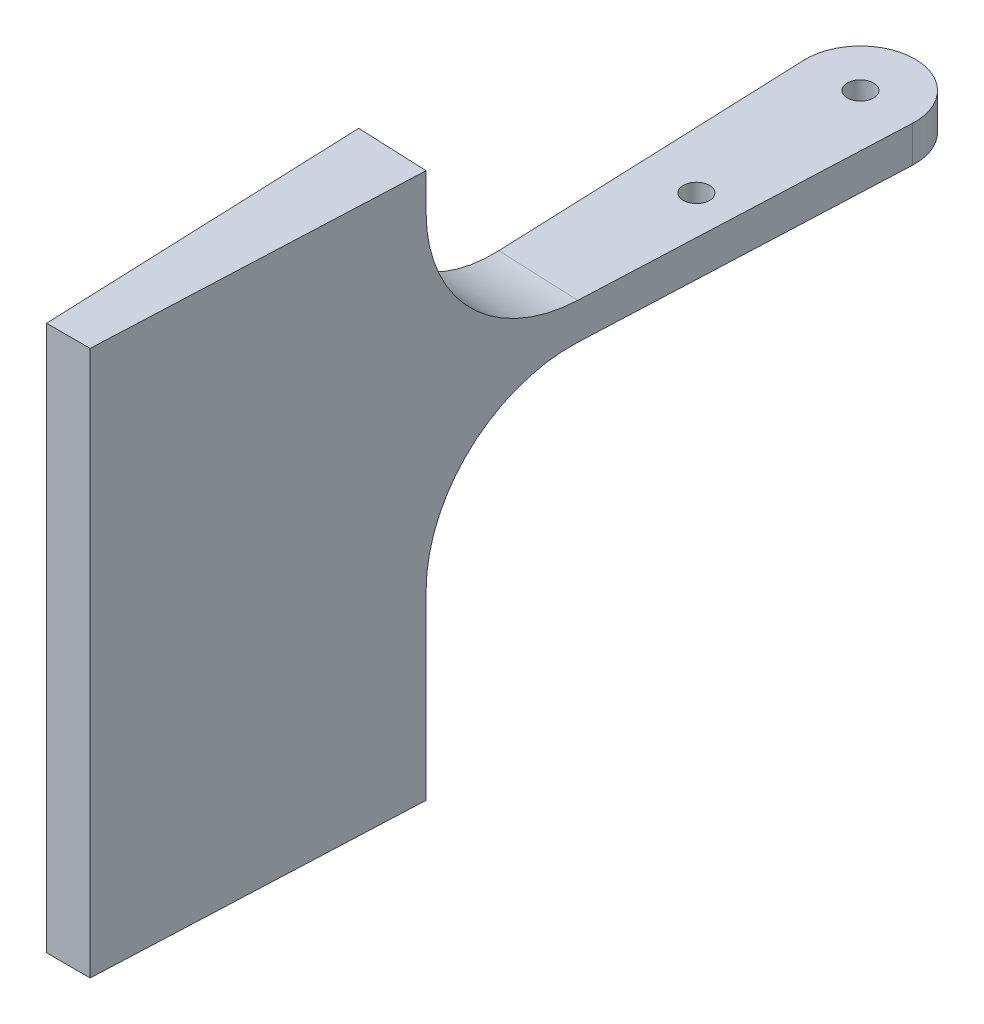
from build123d import *

# Parameters (mm, degrees)
BOSS_EXTRUDE1_DEPTH      = 5
BOSS_EXTRUDE2_DEPTH      = 25
BOSS_EXTRUDE2_DEPTH_BACK = 50
FILLET1_R                = 20
SKETCH3_R                = 1.8
CUT_EXTRUDE1_DEPTH       = 19


with BuildPart() as part:
    # Sketch1 → Boss-Extrude1 (new body)
    with BuildSketch(Plane(origin=(0, 0, 0), x_dir=(1, 0, 0), z_dir=(0, 1, 0))):
        with BuildLine():
            Line((-4.24425851, -7.793409934), (0, -116.2))
            Line((0, -116.2), (6, -116.2))
            Line((6, -116.2), (10.742827875, -7.827918338))
            ThreePointArc((10.742827875, -7.827918338), (3.267269023, -1.9881e-05), (-4.24425851, -7.793409934))
        make_face()
    extrude(amount=BOSS_EXTRUDE1_DEPTH)

    # Sketch2 → Boss-Extrude2 (add, two sides: drawn at the far end of the back side and taken through both)
    with BuildSketch(Plane(origin=(0, 5, 0), x_dir=(1, 0, 0), z_dir=(0, 1, 0)).offset(-BOSS_EXTRUDE2_DEPTH_BACK)):
        Polygon((-1.749928594, -71.503431366), (7.937559289, -71.927397454), (6, -116.2), (0, -116.2), align=None)
    extrude(amount=BOSS_EXTRUDE2_DEPTH + BOSS_EXTRUDE2_DEPTH_BACK)

    # Fillet1
    fillet1_edges = [part.edges().sort_by_distance(p)[0] for p in [
        (3.093815347, 0, 71.71541441),
        (3.093815347, 5, 71.71541441),
    ]]
    fillet(fillet1_edges, radius=FILLET1_R)

    # Sketch3 → Cut-Extrude1 (cut)
    with BuildSketch(Plane(origin=(0, 5, 0), x_dir=(1, 0, 0), z_dir=(0, 1, 0))):
        with Locations((3.25, -7.5)):
            Circle(SKETCH3_R)
        with Locations((4.169351127, -30.982009997)):
            Circle(SKETCH3_R)
    extrude(amount=-CUT_EXTRUDE1_DEPTH, mode=Mode.SUBTRACT)


solid = part.part
